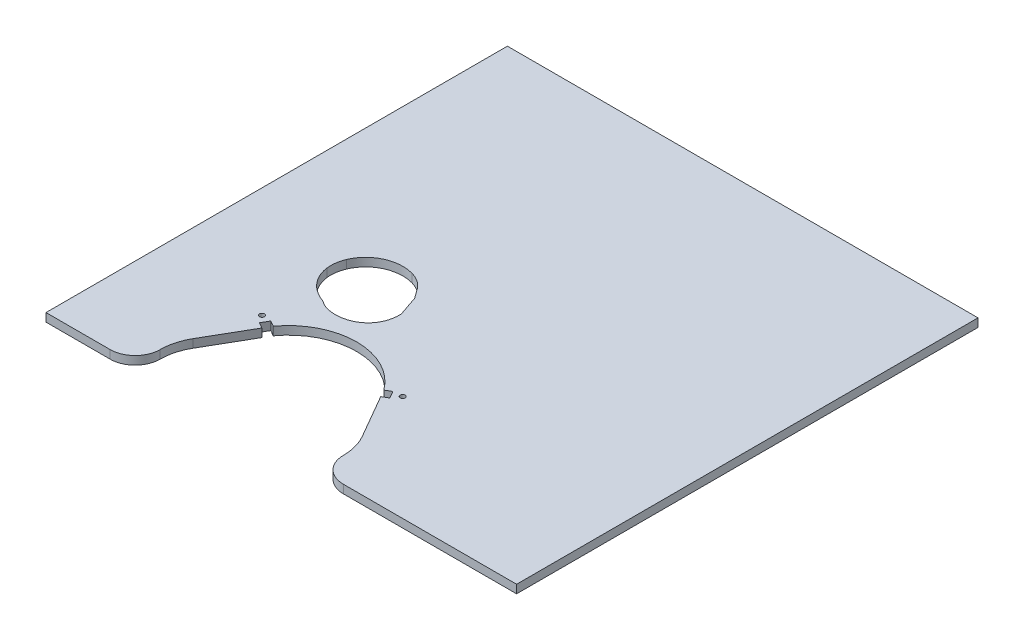
from build123d import *

# Parameters (mm, degrees)
ESQUISSE1_W             = 282.497861144
ESQUISSE1_H             = 276.982873123
BOSS_EXTRU_1_DEPTH      = 5
ESQUISSE2_R             = 1.5
ENL_V_MAT_EXTRU_2_DEPTH = 284.291382269
ENL_V_MAT_EXTRU_3_DEPTH = 284.291382269


with BuildPart() as part:
    # Esquisse1 → Boss.-Extru.1 (new body)
    with BuildSketch(Plane(origin=(0, 0, 0), x_dir=(1, 0, 0), z_dir=(0, 1, 0))):
        with Locations((0.748930572, -106.591436562)):
            Rectangle(ESQUISSE1_W, ESQUISSE1_H)
    extrude(amount=BOSS_EXTRU_1_DEPTH)

    # Esquisse2 → Enlèv. mat.-Extru.2 (cut, through all)
    with BuildSketch(Plane(origin=(0, 0, 0), x_dir=(1, 0, 0), z_dir=(0, 1, 0))):
        with Locations((-74.225778058, -181.665063509)):
            Circle(ESQUISSE2_R)
        with Locations((10.225778058, -181.665063509)):
            Circle(ESQUISSE2_R)
        with BuildLine():
            Line((-65.181549424, -184), (-68.645651039, -182))
            Line((-68.645651039, -182), (-71.145651039, -186.330127019))
            Line((-71.145651039, -186.330127019), (-67.681549424, -188.330127019))
            Line((-67.681549424, -188.330127019), (-82.853895909, -214.609402001))
            ThreePointArc((-82.853895909, -214.609402001), (-85.945508514, -222.073215083), (-87, -230.082873123))
            ThreePointArc((-87, -230.082873123), (-91.393398282, -240.68947484), (-102, -245.082873123))
            Line((-102, -245.082873123), (38, -245.082873123))
            ThreePointArc((38, -245.082873123), (27.393398282, -240.68947484), (23, -230.082873123))
            ThreePointArc((23, -230.082873123), (21.945508514, -222.073215083), (18.853895909, -214.609402001))
            Line((18.853895909, -214.609402001), (3.681549424, -188.330127019))
            Line((3.681549424, -188.330127019), (7.145651039, -186.330127019))
            Line((7.145651039, -186.330127019), (4.645651039, -182))
            Line((4.645651039, -182), (1.181549424, -184))
            ThreePointArc((1.181549424, -184), (-32, -167.082873123), (-65.181549424, -184))
        make_face()
    extrude(amount=ENL_V_MAT_EXTRU_2_DEPTH, mode=Mode.SUBTRACT)

    # Esquisse3 → Enlèv. mat.-Extru.3 (cut, through all)
    with BuildSketch(Plane(origin=(0, 5, 0), x_dir=(1, 0, 0), z_dir=(0, 1, 0))):
        with BuildLine():
            Line((-37.232196293, -127.056876517), (-33.124706917, -139.131217425))
            add(Edge.make_bspline(
                [(-33.124706917, -139.131217425), (-32.973443286, -141.562315427), (-33.240501714, -144.066449507), (-33.974458359, -146.389039833)],
                knots=[0, 0, 0, 0, 1, 1, 1, 1], degree=3))
            add(Edge.make_bspline(
                [(-33.974458359, -146.389039833), (-34.240939918, -147.232315109), (-34.901711614, -148.887186594), (-36.222092456, -151.16859082), (-37.896145941, -153.271950606), (-39.173925278, -154.467879681), (-39.85436264, -155.020953925)],
                knots=[0, 0, 0, 0, 0.25, 0.5, 0.75, 1, 1, 1, 1], degree=3))
            add(Edge.make_bspline(
                [(-39.85436264, -155.020953925), (-41.102216947, -156.035236967), (-43.895257319, -157.732816873), (-46.966969366, -158.683613706), (-48.535872906, -158.982350321)],
                knots=[0, 0, 0, 0, 0.5, 1, 1, 1, 1], degree=3))
            add(Edge.make_bspline(
                [(-48.535872906, -158.982350321), (-51.13944429, -159.478099156), (-53.882867983, -159.47574722), (-56.48692049, -158.982531853)],
                knots=[0, 0, 0, 0, 1, 1, 1, 1], degree=3))
            add(Edge.make_bspline(
                [(-56.48692049, -158.982531853), (-56.973436213, -158.890384314), (-57.941516847, -158.671807697), (-59.005577298, -158.35218813), (-59.710739171, -158.106116095), (-60.049063692, -157.981027978), (-60.432325993, -157.83427396), (-60.839616411, -157.629085383), (-61.162137671, -157.444280488), (-61.493584438, -157.24405871), (-61.822631153, -157.027085358), (-62.019194439, -156.890401704), (-62.119773387, -156.820266925)],
                knots=[0, 0, 0, 0, 0.25, 0.5, 0.5625, 0.625, 0.6875, 0.75, 0.8125, 0.875, 0.9375, 1, 1, 1, 1], degree=3))
            add(Edge.make_bspline(
                [(-62.119773387, -156.820266925), (-62.342584678, -156.664898224), (-62.821161133, -156.320773011), (-63.357830194, -156.028764531), (-64.135810805, -155.694321533), (-65.127753562, -155.272422312), (-66.441462171, -154.713730904), (-67.715247509, -154.070015017), (-68.736091579, -153.463400683), (-69.671055675, -152.853125374), (-71.3254583, -151.704430932), (-73.461253558, -149.797913164), (-75.688909234, -147.123366593), (-78.04573381, -143.184617989), (-79.065572969, -139.797016013), (-79.336044542, -137.516218816)],
                knots=[0, 0, 0, 0, 0.03125, 0.0625, 0.09375, 0.125, 0.1875, 0.25, 0.28125, 0.3125, 0.375, 0.5, 0.625, 0.75, 1, 1, 1, 1], degree=3))
            add(Edge.make_bspline(
                [(-79.336044542, -137.516218816), (-79.538851292, -135.806016663), (-79.497059046, -132.31446777), (-78.577583293, -128.96502082), (-77.925114795, -127.375270768)],
                knots=[0, 0, 0, 0, 0.5, 1, 1, 1, 1], degree=3))
            add(Edge.make_bspline(
                [(-77.925114795, -127.375270768), (-77.413093619, -126.127722888), (-76.152455528, -123.733716988), (-73.576150351, -120.520293649), (-70.491201583, -117.918915096), (-66.929943003, -115.889711454), (-63.128151034, -114.553617023), (-59.09810731, -113.890404675), (-55.046815493, -113.938774256), (-52.377232563, -114.445148274), (-51.081266578, -114.817883607)],
                knots=[0, 0, 0, 0, 0.125, 0.25, 0.375, 0.5, 0.625, 0.75, 0.875, 1, 1, 1, 1], degree=3))
            add(Edge.make_bspline(
                [(-51.081266578, -114.817883607), (-50.14238246, -115.087917919), (-48.310567547, -115.747973194), (-46.103484983, -116.93355719), (-44.482075864, -118.081051527), (-43.310697029, -119.096824351), (-42.307582377, -120.188793074), (-41.695859436, -120.936019919), (-41.39519288, -121.317167086)],
                knots=[0, 0, 0, 0, 0.25, 0.5, 0.625, 0.75, 0.875, 1, 1, 1, 1], degree=3))
            add(Edge.make_bspline(
                [(-41.39519288, -121.317167086), (-40.6647314, -122.243154093), (-39.610141308, -123.682254904), (-38.253536633, -125.564961028), (-37.556455375, -126.553796492), (-37.232196293, -127.056876517)],
                knots=[0, 0, 0, 0, 0.5, 0.75, 1, 1, 1, 1], degree=3))
        make_face()
    extrude(amount=-ENL_V_MAT_EXTRU_3_DEPTH, mode=Mode.SUBTRACT)


solid = part.part
